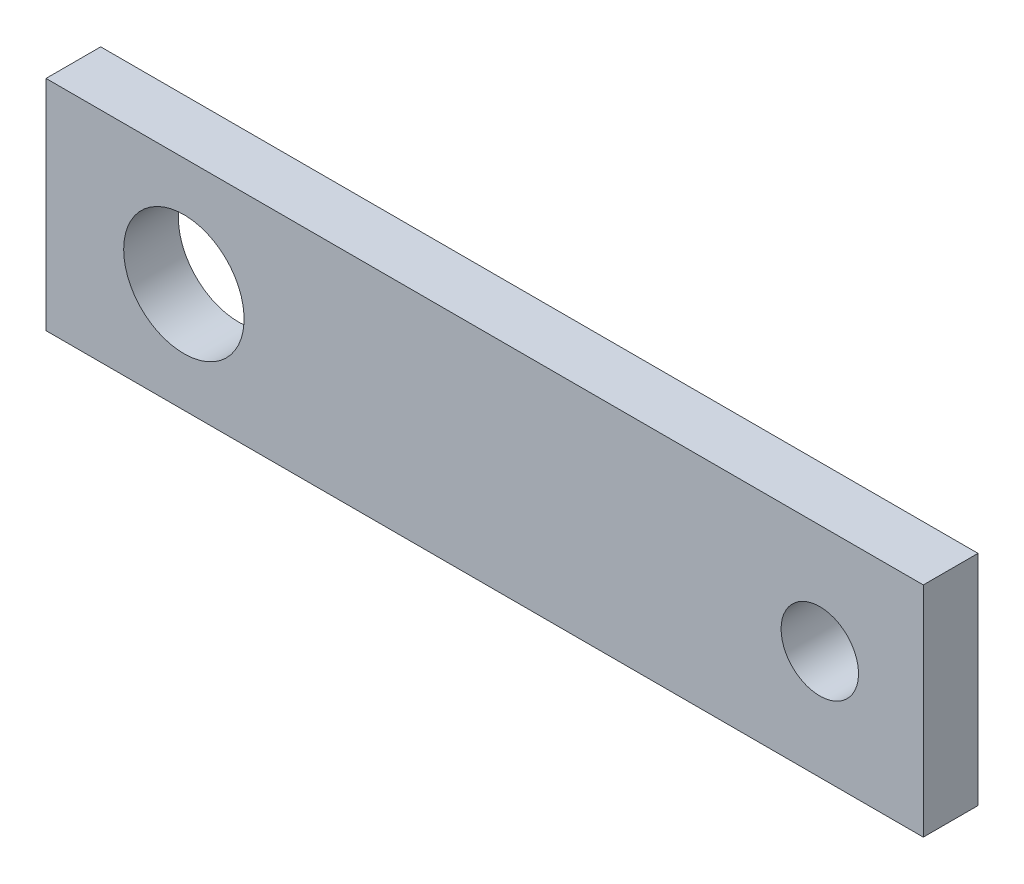
from build123d import *

# Parameters (mm, degrees)
ESBO_O1_W             = 51
ESBO_O1_H             = 12.7
FLANGE_BASE1_DEPTH    = 3.18
ESBO_O2_R             = 3.5
ESBO_O2_R_2           = 2.25
CORTE_EXTRUS_O1_DEPTH = 10


# Sheet-metal steps are written as plain solids
with BuildPart() as part:
    # Esboço1 → Flange-base1 (new body)
    with BuildSketch(Plane.XY):
        Rectangle(ESBO_O1_W, ESBO_O1_H)
    extrude(amount=-FLANGE_BASE1_DEPTH)

    # Esboço2 → Corte-extrusão1 (cut)
    with BuildSketch(Plane(origin=(0, 0, -3.18), x_dir=(-1, 0, 0), z_dir=(0, 0, -1))):
        with Locations((17.485, 0)):
            Circle(ESBO_O2_R)
        with Locations((-19.4825, 0)):
            Circle(ESBO_O2_R_2)
    extrude(amount=-CORTE_EXTRUS_O1_DEPTH, mode=Mode.SUBTRACT)


solid = part.part
